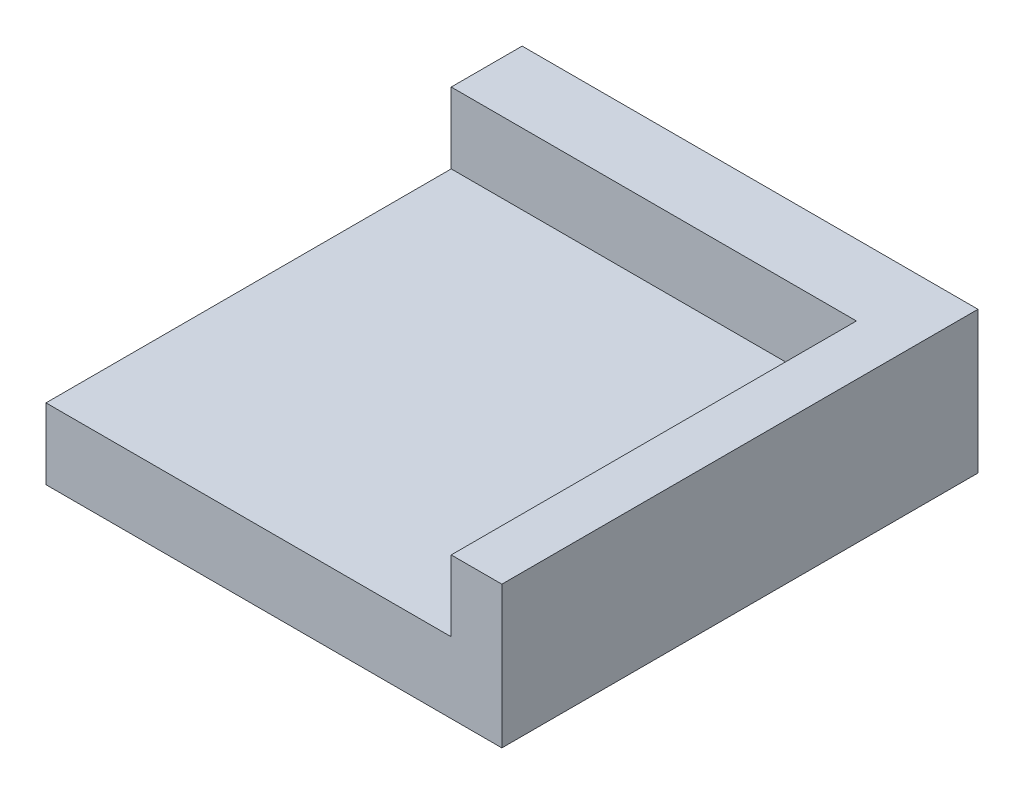
from build123d import *

# Parameters (mm, degrees)
SALIENTE_EXTRUIR1_DEPTH = 225
CROQUIS4_W              = 25
CROQUIS4_H              = 35
SALIENTE_EXTRUIR2_DEPTH = 200


with BuildPart() as part:
    # Croquis3 → Saliente-Extruir1 (new body)
    with BuildSketch(Plane(origin=(0, 0, 0), x_dir=(0, 0, -1), z_dir=(1, 0, 0))):
        Polygon((-565.416095406, 389.667139927), (-765.416095406, 389.667139927), (-765.416095406, 354.667139927), (-530.416095406, 354.667139927), (-530.416095406, 424.667139927), (-565.416095406, 424.667139927), align=None)
    extrude(amount=SALIENTE_EXTRUIR1_DEPTH)

    # Croquis4 → Saliente-Extruir2 (add)
    with BuildSketch(Plane.XY.offset(565.416095406)):
        with Locations((212.5, 407.167139927)):
            Rectangle(CROQUIS4_W, CROQUIS4_H)
    extrude(amount=SALIENTE_EXTRUIR2_DEPTH)


solid = part.part
